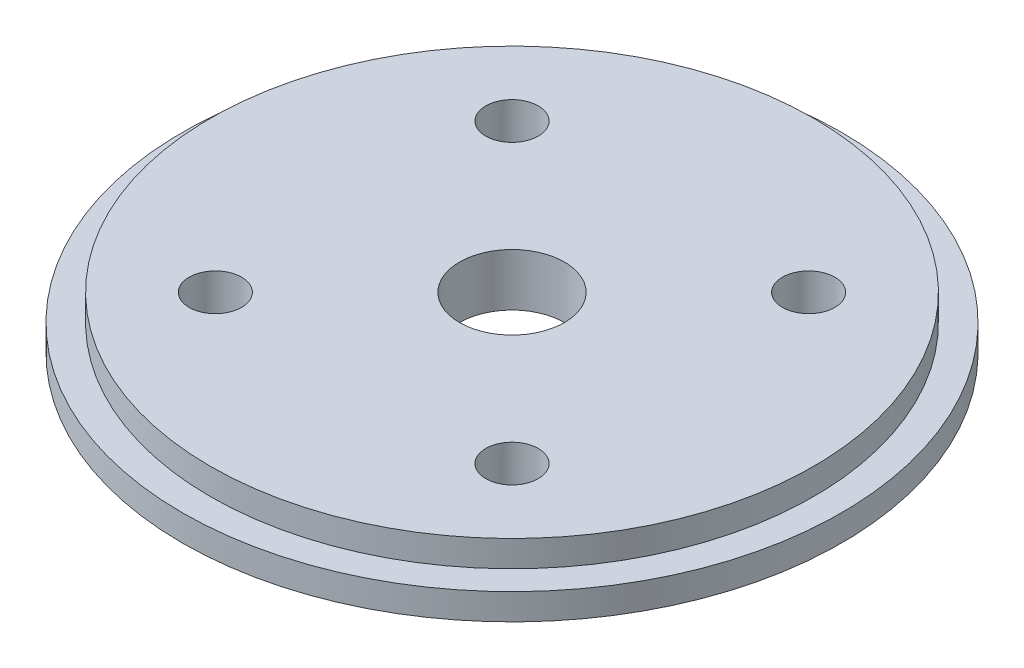
from build123d import *

# Parameters (mm, degrees)
SKETCH2_R                   = 39.9034
BOSS_EXTRUDE1_DEPTH         = 6.35
CUT_EXTRUDE1_START          = -3.175
SKETCH4_R                   = 39.9034
SKETCH4_R_2                 = 36.5125
CUT_EXTRUDE1_DEPTH          = 3.175
F_1_4_0_25_DIAMETER_HOLE1_D = 6.35
F_1_2_0_5_DIAMETER_HOLE1_D  = 12.7
SKETCH9_R                   = 6.0325
CUT_EXTRUDE2_DEPTH          = 1.5875


with BuildPart() as part:
    # Sketch2 → Boss-Extrude1 (new body)
    with BuildSketch(Plane(origin=(0, 0, 0), x_dir=(1, 0, 0), z_dir=(0, 1, 0))):
        Circle(SKETCH2_R)
    extrude(amount=BOSS_EXTRUDE1_DEPTH)

    # Sketch4 → Cut-Extrude1 (cut)
    with BuildSketch(Plane(origin=(0, 6.35, 0), x_dir=(1, 0, 0), z_dir=(0, 1, 0)).offset(CUT_EXTRUDE1_START)):
        Circle(SKETCH4_R)
        Circle(SKETCH4_R_2, mode=Mode.SUBTRACT)
    extrude(amount=CUT_EXTRUDE1_DEPTH, mode=Mode.SUBTRACT)

    # 1/4 (0.25) Diameter Hole1 (through all)
    with Locations(Plane(origin=(0, 6.35, 0), x_dir=(1, 0, 0), z_dir=(0, 1, 0))):
        with Locations((-17.960512242, 17.960512242), (-17.960512242, -17.960512242), (17.960512242, 17.960512242), (17.960512242, -17.960512242)):
            Hole(F_1_4_0_25_DIAMETER_HOLE1_D / 2)

    # 1/2 (0.5) Diameter Hole1 (through all)
    with Locations(Plane(origin=(0, 6.35, 0), x_dir=(1, 0, 0), z_dir=(0, 1, 0))):
        with Locations((0, 0)):
            Hole(F_1_2_0_5_DIAMETER_HOLE1_D / 2)

    # Sketch9 → Cut-Extrude2 (cut)
    with BuildSketch(Plane.XZ):
        with Locations((-17.960512242, 17.960512242)):
            Circle(SKETCH9_R)
        with Locations((17.960512242, 17.960512242)):
            Circle(SKETCH9_R)
        with Locations((17.960512242, -17.960512242)):
            Circle(SKETCH9_R)
        with Locations((-17.960512242, -17.960512242)):
            Circle(SKETCH9_R)
    extrude(amount=-CUT_EXTRUDE2_DEPTH, mode=Mode.SUBTRACT)


solid = part.part
